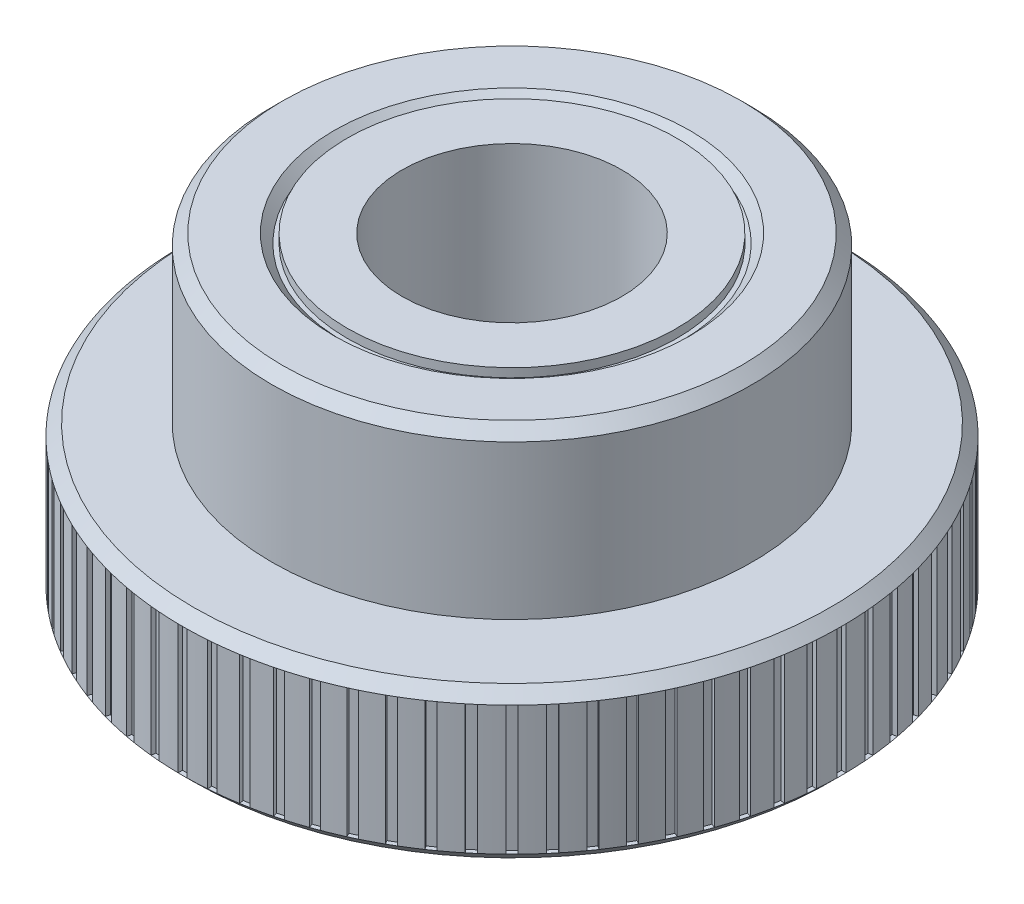
from build123d import *

# Parameters (mm, degrees)
SKETCH3_R               = 3.175
CUT_EXTRUDE1_DEPTH      = 17.271875
CHAMFER1_SIZE           = 0.3175
CUT_EXTRUDE6_REACH      = 27.846
CUT_EXTRUDE6_END_RADIUS = 9.525
SKETCH17_W              = 0.254
SKETCH17_H              = 3.730625
CIRPATTERN1_COUNT       = 72
SKETCH22_R              = 4.8895
SKETCH22_R_2            = 4.7625
CUT_EXTRUDE_THIN1_DEPTH = 0.254
CHAMFER2_SIZE           = 0.254
CUT_EXTRUDE_THIN2_START = -0.254
SKETCH23_R              = 4.8895
SKETCH23_R_2            = 4.7625
CUT_EXTRUDE_THIN2_DEPTH = 0.254
CHAMFER3_SIZE           = 0.254


with BuildPart() as part:
    # Sketch1 → Revolve1 (revolve)
    with BuildSketch(Plane.XY, mode=Mode.PRIVATE) as revolve1_sk:
        Polygon((0, 9.128125), (-6.9453125, 9.128125), (-6.9453125, 4.365625), (-9.525, 4.365625), (-9.525, 0), (0, 0), align=None)
    revolve(revolve1_sk.sketch.rotate(Axis((0, 0, 0), (0, 1, 0)), 270), axis=Axis((0, 0, 0), (0, 1, 0)))

    # Sketch3 → Cut-Extrude1 (cut, through all)
    with BuildSketch(Plane(origin=(0, 0, 0), x_dir=(1, 0, 0), z_dir=(0, 1, 0))):
        with Locations(Location((0, 0, 0), (0, 0, 270))):
            Circle(SKETCH3_R)
    extrude(amount=CUT_EXTRUDE1_DEPTH, mode=Mode.SUBTRACT)

    # Chamfer1
    chamfer1_edges = [part.edges().sort_by_distance(p)[0] for p in [
        (0, 9.128125, 6.9453125),
        (0, 4.365625, 9.525),
        (0, 0, 9.525),
    ]]
    chamfer(chamfer1_edges, length=CHAMFER1_SIZE)

    # Cut-Extrude6: up to this cylinder (the profile starts outside it)
    cut_extrude6_end = Plane(origin=(0, 2.182813, 0.127), z_dir=(0, -1, 0)) * Cylinder(CUT_EXTRUDE6_END_RADIUS, 75.742, mode=Mode.PRIVATE)
    # Sketch17 → Cut-Extrude6 (cut, up to the surface)
    with BuildSketch(Plane.XY.offset(-12.7), mode=Mode.PRIVATE) as cut_extrude6_sk1:
        with Locations((0, 2.1828125)):
            Rectangle(SKETCH17_W, SKETCH17_H)
    cut_extrude6_tool1 = extrude(cut_extrude6_sk1.sketch, amount=CUT_EXTRUDE6_REACH, mode=Mode.PRIVATE) - cut_extrude6_end
    cut_extrude6 = cut_extrude6_tool1.solids().sort_by_distance((0, 2.182813, -12.7))[0]
    add(cut_extrude6, mode=Mode.SUBTRACT)

    # CirPattern1: Cut-Extrude6 ×72 about axis
    cirpattern1_axis = Axis((0, 0, 0), (0, 1, 0))
    for i in range(1, CIRPATTERN1_COUNT):
        add(cut_extrude6.rotate(cirpattern1_axis, i * 360 / CIRPATTERN1_COUNT), mode=Mode.SUBTRACT)

    # Sketch22 → Cut-Extrude-Thin1 (cut)
    with BuildSketch(Plane.XZ):
        Circle(SKETCH22_R)
        Circle(SKETCH22_R_2, mode=Mode.SUBTRACT)
    extrude(amount=-CUT_EXTRUDE_THIN1_DEPTH, mode=Mode.SUBTRACT)

    # Chamfer2
    chamfer2_edges = [part.edges().sort_by_distance(p)[0] for p in [
        (-4.8895, 0, 0),
    ]]
    chamfer(chamfer2_edges, length=CHAMFER2_SIZE - 0.0001)  # a hair under: the kernel refuses the full size

    # Sketch23 → Cut-Extrude-Thin2 (cut)
    with BuildSketch(Plane(origin=(0, 9.128125, 0), x_dir=(1, 0, 0), z_dir=(0, 1, 0)).offset(CUT_EXTRUDE_THIN2_START)):
        Circle(SKETCH23_R)
        Circle(SKETCH23_R_2, mode=Mode.SUBTRACT)
    extrude(amount=CUT_EXTRUDE_THIN2_DEPTH, mode=Mode.SUBTRACT)

    # Chamfer3
    chamfer3_edges = [part.edges().sort_by_distance(p)[0] for p in [
        (-4.8895, 9.128125, 0),
    ]]
    chamfer(chamfer3_edges, length=CHAMFER3_SIZE - 0.0001)  # a hair under: the kernel refuses the full size


solid = part.part
